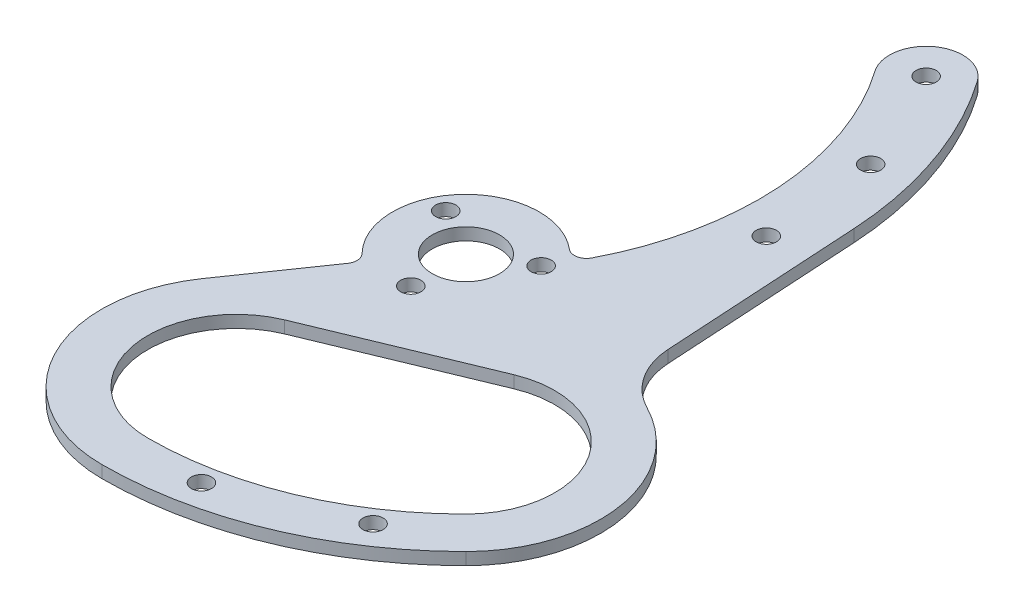
from build123d import *

# Parameters (mm, degrees)
SKETCH_1_R          = 1.65
SKETCH_1_R_2        = 5.5
EXTRUDE_1_DEPTH     = 2
SKETCH_2_R          = 1.65
CUT_EXTRUDE_1_DEPTH = 85.204030668
FILLET_1_R          = 2
FILLET_2_R          = 12


with BuildPart() as part:
    # Эскиз1 → Бобышка-Вытянуть1 (new body)
    with BuildSketch(Plane(origin=(0, 0, 0), x_dir=(1, 0, 0), z_dir=(0, 1, 0))):
        with BuildLine():
            Line((-7.358068948, -9.479389292), (-18.08780174, -24.976764467))
            ThreePointArc((-18.08780174, -24.976764467), (-19.487318719, -47.710015139), (0, -59.5))
            ThreePointArc((0, -59.5), (22.769664226, -54.970832184), (42.072853481, -42.072853481))
            ThreePointArc((42.072853481, -42.072853481), (47.515690449, -19.956460022), (30.451246794, -4.87123226))
            Line((30.451246794, -4.87123226), (28.075866666, 35.356540564))
            ThreePointArc((28.075866666, 35.356540564), (24.846341863, 51.541564262), (17.329317504, 66.234391334))
            ThreePointArc((17.329317504, 66.234391334), (8.97294662, 67.707844982), (7.499492972, 59.351474098))
            ThreePointArc((7.499492972, 59.351474098), (16.145431017, 33.64630977), (9.479389292, 7.358068948))
            ThreePointArc((9.479389292, 7.358068948), (-8.485281374, 8.485281374), (-7.358068948, -9.479389292))
        make_face()
        with Locations((10.729967711, -53.943190422)):
            Circle(SKETCH_1_R, mode=Mode.SUBTRACT)
        with Locations((30.556362816, -45.730828677)):
            Circle(SKETCH_1_R, mode=Mode.SUBTRACT)
        Circle(SKETCH_1_R_2, mode=Mode.SUBTRACT)
        with Locations((0, -9)):
            Circle(SKETCH_1_R, mode=Mode.SUBTRACT)
        with Locations((-7.794228634, 4.5)):
            Circle(SKETCH_1_R, mode=Mode.SUBTRACT)
        with Locations((7.794228634, 4.5)):
            Circle(SKETCH_1_R, mode=Mode.SUBTRACT)
        with BuildLine():
            Line((-5.548909769, -24.103746779), (20.967594525, -13.120251073))
            ThreePointArc((20.967594525, -13.120251073), (38.572813673, -18.460735916), (36.769552622, -36.769552622))
            ThreePointArc((36.769552622, -36.769552622), (19.899538483, -48.041735691), (0, -52))
            ThreePointArc((0, -52), (-14.221386566, -40.328809669), (-5.548909769, -24.103746779))
        make_face(mode=Mode.SUBTRACT)
    extrude(amount=EXTRUDE_1_DEPTH)

    # Эскиз2 → Вырез-Вытянуть1 (cut, through all)
    with BuildSketch(Plane.XZ):
        with Locations((21.974708544, -27.113395045)):
            Circle(SKETCH_2_R)
        with Locations((12.414405238, -62.792932716)):
            Circle(SKETCH_2_R)
        with Locations((20.340189466, -45.796033589)):
            Circle(SKETCH_2_R)
    extrude(amount=-CUT_EXTRUDE_1_DEPTH, mode=Mode.SUBTRACT)

    # Скругление1
    fillet_1_edges = [part.edges().sort_by_distance(p)[0] for p in [
        (9.479389292, 1, -7.358068948),
        (-7.358068948, 1, 9.479389292),
    ]]
    fillet(fillet_1_edges, radius=FILLET_1_R)

    # Скругление2
    fillet_2_edges = [part.edges().sort_by_distance(p)[0] for p in [
        (30.451246794, 1, 4.87123226),
    ]]
    fillet(fillet_2_edges, radius=FILLET_2_R)


solid = part.part
